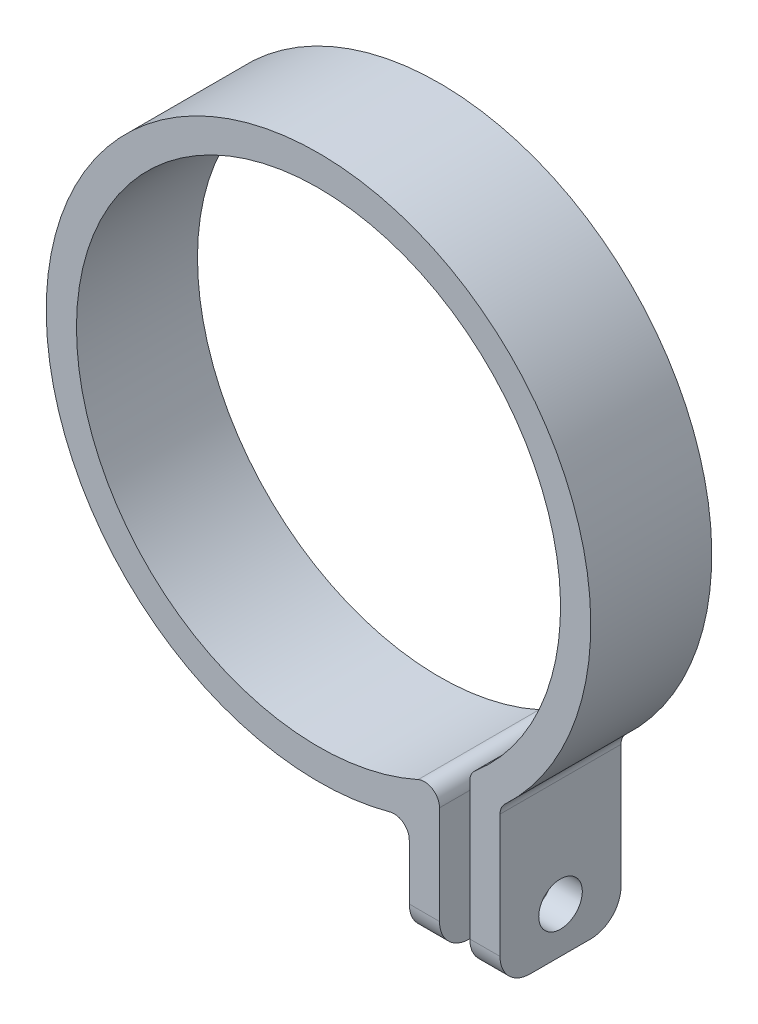
from build123d import *

# Parameters (mm, degrees)
BOSS_EXTRUDE1_DEPTH = 6.35
SKETCH2_R           = 2.286
CUT_EXTRUDE1_DEPTH  = 55.254423783
FILLET1_R           = 1.5875
FILLET2_R           = 3.175


with BuildPart() as part:
    # Sketch1 → Boss-Extrude1 (new, symmetric)
    with BuildSketch(Plane.XY):
        with BuildLine():
            Line((12.7, -21.997045256), (12.7, -38.1))
            Line((12.7, -38.1), (9.525, -38.1))
            Line((9.525, -38.1), (9.525, -26.940768363))
            ThreePointArc((9.525, -26.940768363), (-14.563355395, 24.585347357), (19.05, -21.298547486))
            Line((19.05, -21.298547486), (19.05, -38.1))
            Line((19.05, -38.1), (15.875, -38.1))
            Line((15.875, -38.1), (15.875, -19.827868645))
            ThreePointArc((15.875, -19.827868645), (-14.328607331, 20.9726253), (12.7, -21.997045256))
        make_face()
    extrude(amount=BOSS_EXTRUDE1_DEPTH, both=True)

    # Sketch2 → Cut-Extrude1 (cut, through all)
    with BuildSketch(Plane.ZY.offset(-9.525)):
        with Locations((0, -33.3375)):
            Circle(SKETCH2_R)
    extrude(amount=-CUT_EXTRUDE1_DEPTH, mode=Mode.SUBTRACT)

    # Fillet1
    fillet1_edges = [part.edges().sort_by_distance(p)[0] for p in [
        (9.525, -26.940768363, 0),
        (19.05, -21.298547486, 0),
        (12.7, -21.997045256, 0),
        (15.875, -19.827868645, 0),
    ]]
    fillet(fillet1_edges, radius=FILLET1_R)

    # Fillet2
    fillet2_edges = [part.edges().sort_by_distance(p)[0] for p in [
        (11.1125, -38.1, -6.35),
        (17.4625, -38.1, -6.35),
        (17.4625, -38.1, 6.35),
        (11.1125, -38.1, 6.35),
    ]]
    fillet(fillet2_edges, radius=FILLET2_R)


solid = part.part
